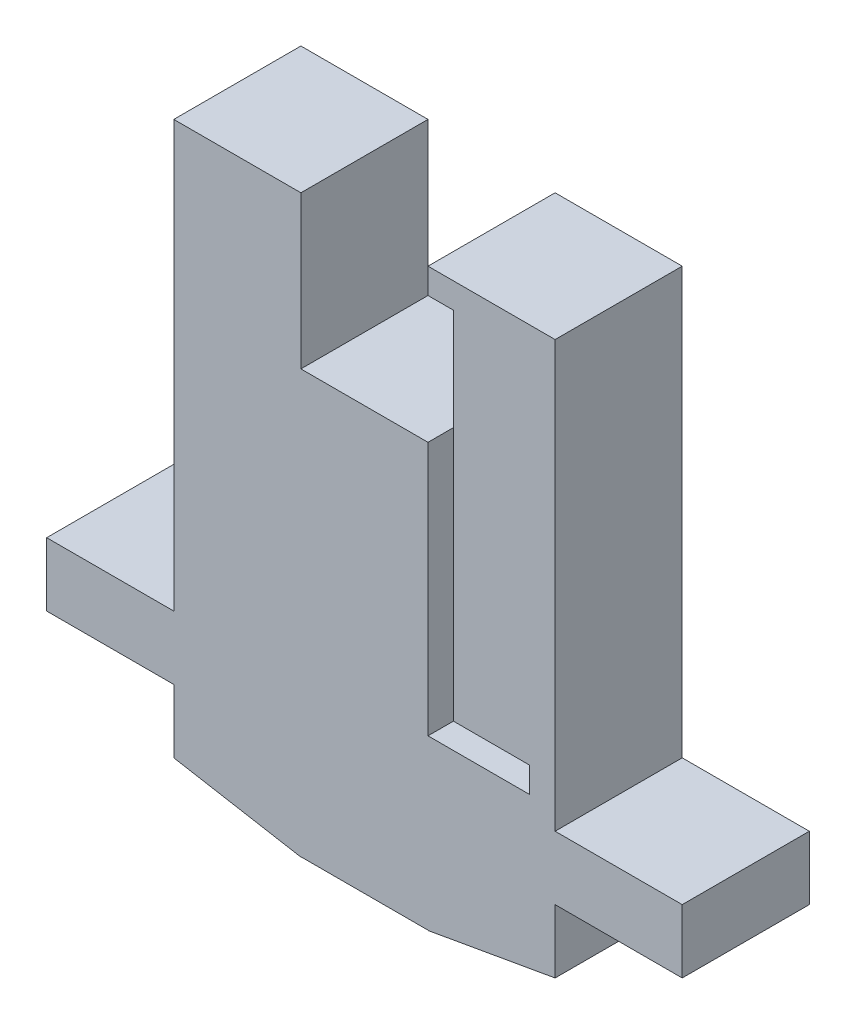
from build123d import *

# Parameters (mm, degrees)
SKETCH2_W           = 19.05
SKETCH2_H           = 31.75
BOSS_EXTRUDE1_DEPTH = 3.175
CUT_EXTRUDE1_DEPTH  = 23.857707289
CUT_EXTRUDE2_DEPTH  = 23.857707289
CUT_EXTRUDE3_DEPTH  = 20.572014459
SKETCH8_W           = 6.35
SKETCH8_H           = 3.175
BOSS_EXTRUDE2_DEPTH = 6.35
SKETCH9_W           = 6.35
SKETCH9_H           = 1.300390549
CUT_EXTRUDE4_DEPTH  = 24.3313898


with BuildPart() as part:
    # Sketch2 → Boss-Extrude1 (new, symmetric)
    with BuildSketch(Plane.XY):
        Rectangle(SKETCH2_W, SKETCH2_H)
    extrude(amount=BOSS_EXTRUDE1_DEPTH, both=True)

    # Sketch4 → Cut-Extrude1 (cut, through all)
    with BuildSketch(Plane(origin=(-1.506852909, 3.110534069, 3.175), x_dir=(1, 0, 0), z_dir=(0, 0, 1))):
        Polygon((-8.018147091, 12.764465931), (-8.018147091, 10.224465931), (-1.668147091, 10.224465931), (-1.668147091, 2.604465931), (4.681852909, 2.604465931), (4.681852909, 10.224465931), (11.031852909, 10.224465931), (11.031852909, 12.764465931), align=None)
    extrude(amount=-CUT_EXTRUDE1_DEPTH, mode=Mode.SUBTRACT)

    # Sketch6 → Cut-Extrude2 (cut, through all)
    with BuildSketch(Plane(origin=(-1.506852909, 3.110534069, 3.175), x_dir=(1, 0, 0), z_dir=(0, 0, 1))):
        Polygon((5.951852909, 8.954465931), (4.681852909, 8.954465931), (4.681852909, -10.095534069), (9.761852909, -10.095534069), (9.761852909, -8.825534069), (5.951852909, -8.825534069), align=None)
    extrude(amount=-CUT_EXTRUDE2_DEPTH, mode=Mode.SUBTRACT)

    # Sketch7 → Cut-Extrude3 (cut, through all)
    with BuildSketch(Plane.XY.offset(3.175)):
        Polygon((-9.525, -14.2875), (-0.521840111, -15.875), (-9.525, -15.875), align=None)
    cut_extrude3 = extrude(amount=-CUT_EXTRUDE3_DEPTH, mode=Mode.SUBTRACT)

    # Mirror1: Cut-Extrude3 across plane
    add(cut_extrude3.mirror(Plane(origin=(0, 0, 0), x_dir=(0, 0, 1), z_dir=(1, 0, 0))), mode=Mode.SUBTRACT)

    # Sketch8 → Boss-Extrude2 (add)
    with BuildSketch(Plane.XY.offset(3.175)):
        with Locations((-12.7, -9.525)):
            Rectangle(SKETCH8_W, SKETCH8_H)
    boss_extrude2 = extrude(amount=-BOSS_EXTRUDE2_DEPTH)

    # Mirror3: Boss-Extrude2 across plane
    add(boss_extrude2.mirror(Plane(origin=(0, 0, 0), x_dir=(0, 0, 1), z_dir=(1, 0, 0))))

    # Sketch9 → Cut-Extrude4 (cut, through all)
    with BuildSketch(Plane.XY.offset(3.175)):
        with Locations((0, -16.043267549)):
            Rectangle(SKETCH9_W, SKETCH9_H)
    extrude(amount=-CUT_EXTRUDE4_DEPTH, mode=Mode.SUBTRACT)


solid = part.part
